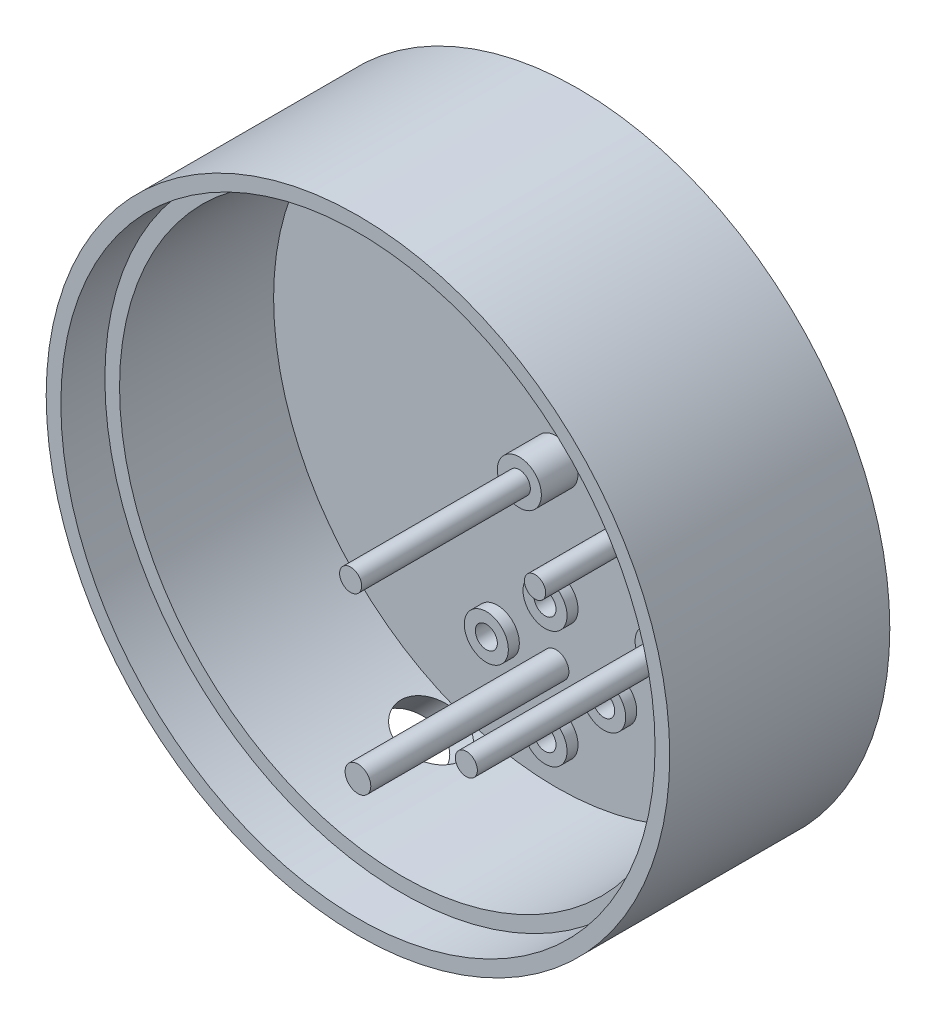
from build123d import *

# Parameters (mm, degrees)
SKETCH_1_R              = 42.5
SKETCH_1_R_2            = 40.5
EXTRUDE_1_DEPTH         = 30
SKETCH_2_R              = 40.5
SKETCH_2_R_2            = 38.5
EXTRUDE_2_DEPTH         = 24
EXTRUDE_3_OUTLINE_R     = 38.5
EXTRUDE_3_DEPTH         = 3
SKETCH_5_R              = 1.75
EXTRUDE_4_DEPTH         = 27
SKETCH_10_R             = 3
EXTRUDE_10_DEPTH        = 1.5
SKETCH_21_R             = 1.5
CUT_EXTRUDE_1_DEPTH     = 66.289738857
SKETCH_6_R              = 1.5
EXTRUDE_5_DEPTH         = 28
SKETCH_7_R              = 3
EXTRUDE_6_DEPTH         = 2
SKETCH_8_R              = 1.45
EXTRUDE_7_DEPTH         = 21
SKETCH_9_R              = 3
EXTRUDE_8_DEPTH         = 2
SKETCH_22_R             = 2.5
CUT_EXTRUDE_2_DEPTH     = 1
SKETCH_23_R             = 1.5
EXTRUDE_11_DEPTH        = 28
SKETCH_25_R             = 3
EXTRUDE_12_DEPTH        = 5
CUT_EXTRUDE_START       = -40.635067554
CUT_EXTRUDE_3_OUTLINE_R = 4
CUT_EXTRUDE_3_DEPTH     = 8.016303225


# Read off the part's stored shape, not the designer's step: 凸台-拉伸3, 切除-拉伸3
with BuildPart() as part:
    # 草图1 → 凸台-拉伸1 (new body)
    with BuildSketch(Plane.XY):
        Circle(SKETCH_1_R)
        Circle(SKETCH_1_R_2, mode=Mode.SUBTRACT)
    extrude(amount=EXTRUDE_1_DEPTH)

    # 草图2 → 凸台-拉伸2 (add)
    with BuildSketch(Plane.XY):
        Circle(SKETCH_2_R)
        Circle(SKETCH_2_R_2, mode=Mode.SUBTRACT)
    extrude(amount=EXTRUDE_2_DEPTH)

    # 凸台-拉伸3 outline → 凸台-拉伸3 (add)
    with BuildSketch(Plane.XY):
        Circle(EXTRUDE_3_OUTLINE_R)
    extrude(amount=EXTRUDE_3_DEPTH)

    # 草图5 → 凸台-拉伸4 (add)
    with BuildSketch(Plane.XY.offset(3)):
        with Locations((0, -24)):
            Circle(SKETCH_5_R)
    extrude(amount=EXTRUDE_4_DEPTH)

    # 草图10 → 凸台-拉伸10 (add)
    with BuildSketch(Plane.XY.offset(3)):
        with Locations((8, -24)):
            Circle(SKETCH_10_R)
        with Locations((0, -16)):
            Circle(SKETCH_10_R)
        with Locations((-8, -24)):
            Circle(SKETCH_10_R)
        with Locations((0, -32)):
            Circle(SKETCH_10_R)
    extrude(amount=EXTRUDE_10_DEPTH)

    # 草图21 → 切除-拉伸1 (cut, through all)
    with BuildSketch(Plane.XY.offset(4.5)):
        with Locations((-8, -24)):
            Circle(SKETCH_21_R)
        with Locations((0, -16)):
            Circle(SKETCH_21_R)
        with Locations((8, -24)):
            Circle(SKETCH_21_R)
        with Locations((0, -32)):
            Circle(SKETCH_21_R)
    extrude(amount=-CUT_EXTRUDE_1_DEPTH, mode=Mode.SUBTRACT)

    # 草图6 → 凸台-拉伸5 (add)
    with BuildSketch(Plane.XY.offset(3)):
        with Locations((15.773694335, -13.86328125)):
            Circle(SKETCH_6_R)
    extrude(amount=EXTRUDE_5_DEPTH)

    # 草图7 → 凸台-拉伸6 (add)
    with BuildSketch(Plane.XY.offset(3)):
        with Locations((15.773694335, -13.86328125)):
            Circle(SKETCH_7_R)
    extrude(amount=EXTRUDE_6_DEPTH)

    # 草图8 → 凸台-拉伸7 (add)
    with BuildSketch(Plane.XY.offset(3)):
        with Locations(Location((18.141870405, 4.736563967, 0), (0, 0, 180))):
            Circle(SKETCH_8_R)
    extrude(amount=EXTRUDE_7_DEPTH)

    # 草图9 → 凸台-拉伸8 (add)
    with BuildSketch(Plane.XY.offset(3)):
        with Locations((18.141870405, 4.736563967)):
            Circle(SKETCH_9_R)
    extrude(amount=EXTRUDE_8_DEPTH)

    # 草图22 → 切除-拉伸2 (cut)
    with BuildSketch(Plane(origin=(0, 0, 0), x_dir=(-1, 0, 0), z_dir=(0, 0, -1))):
        with Locations((-8, -24)):
            Circle(SKETCH_22_R)
        with Locations((0, -16)):
            Circle(SKETCH_22_R)
        with Locations((8, -24)):
            Circle(SKETCH_22_R)
        with Locations((0, -32)):
            Circle(SKETCH_22_R)
    extrude(amount=-CUT_EXTRUDE_2_DEPTH, mode=Mode.SUBTRACT)

    # 草图23 → 凸台-拉伸11 (add)
    with BuildSketch(Plane.XY.offset(3)):
        Circle(SKETCH_23_R)
    extrude(amount=EXTRUDE_11_DEPTH)

    # 草图25 → 凸台-拉伸12 (add)
    with BuildSketch(Plane.XY.offset(3)):
        Circle(SKETCH_25_R)
    extrude(amount=EXTRUDE_12_DEPTH)

    # 切除-拉伸3 outline → 切除-拉伸3 (cut)
    with BuildSketch(Plane(origin=(0, 0, 0), x_dir=(0.707106781186546, -0.707106781186549, 0), z_dir=(0.707106781186549, 0.707106781186546, 0)).offset(CUT_EXTRUDE_START)):
        with Locations((16.451557856, -7.167019764)):
            Circle(CUT_EXTRUDE_3_OUTLINE_R)
    extrude(amount=CUT_EXTRUDE_3_DEPTH, mode=Mode.SUBTRACT)


solid = part.part
